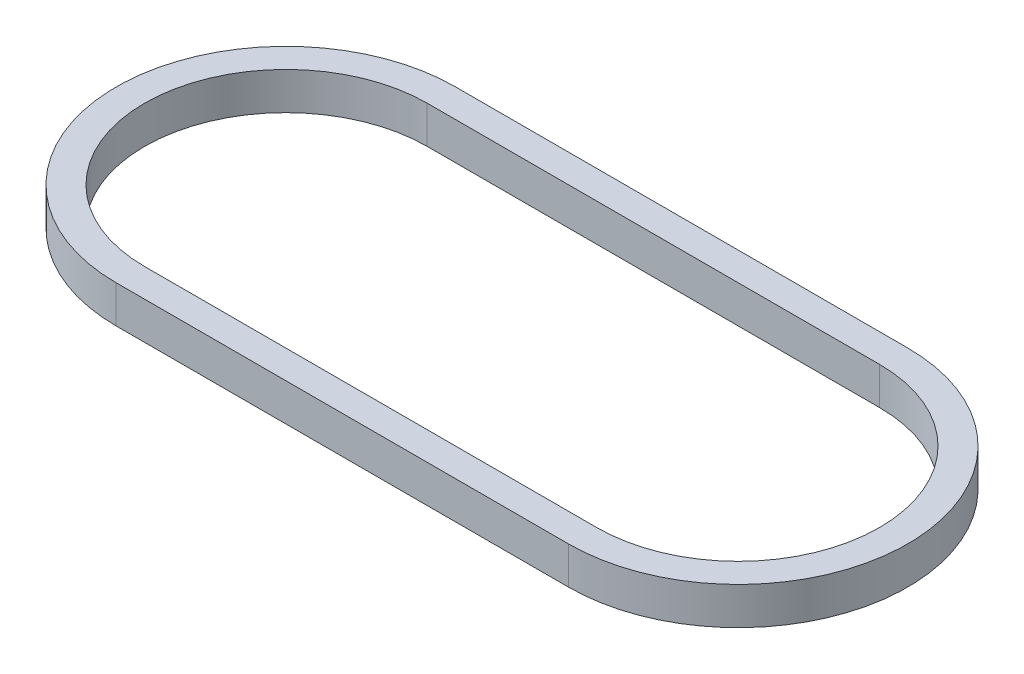
from build123d import *

# Parameters (mm, degrees)
BOSS_EXTRUDE1_DEPTH = 7.7978


with BuildPart() as part:
    # Sketch1 → Boss-Extrude1 (new body)
    with BuildSketch(Plane(origin=(0, 0, 0), x_dir=(1, 0, 0), z_dir=(0, 1, 0))):
        with BuildLine():
            ThreePointArc((-47.1, 35.3387), (-82.4387, 0), (-47.1, -35.3387))
            Line((-47.1, -35.3387), (47.1, -35.3387))
            ThreePointArc((47.1, -35.3387), (82.4387, 0), (47.1, 35.3387))
            Line((47.1, 35.3387), (-47.1, 35.3387))
        make_face()
        with BuildLine():
            Line((47.1, -29.4459), (-47.1, -29.4459))
            ThreePointArc((-47.1, -29.4459), (-76.5459, 0), (-47.1, 29.4459))
            Line((-47.1, 29.4459), (47.1, 29.4459))
            ThreePointArc((47.1, 29.4459), (76.5459, 0), (47.1, -29.4459))
        make_face(mode=Mode.SUBTRACT)
    extrude(amount=BOSS_EXTRUDE1_DEPTH)


solid = part.part
